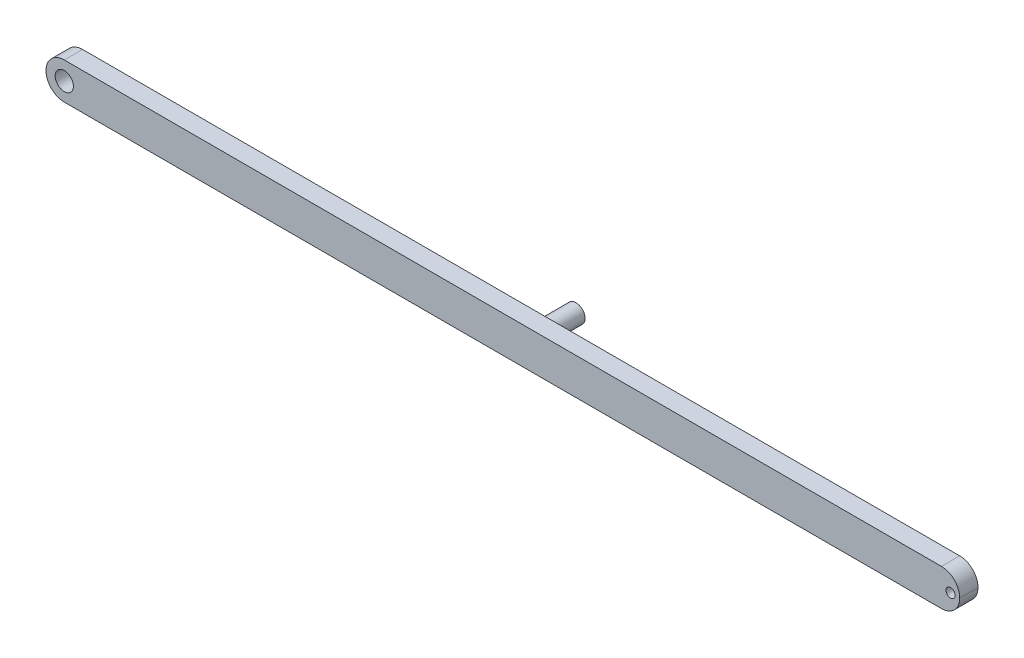
from build123d import *

# Parameters (mm, degrees)
SKETCH1_W           = 500
SKETCH1_H           = 20
SKETCH1_R           = 5
SKETCH1_R_2         = 2.5
BOSS_EXTRUDE1_DEPTH = 10
FILLET1_R           = 10
SKETCH2_R           = 5
BOSS_EXTRUDE2_DEPTH = 20
FILLET2_R           = 5


with BuildPart() as part:
    # Sketch1 → Boss-Extrude1 (new body)
    with BuildSketch(Plane.XY):
        Rectangle(SKETCH1_W, SKETCH1_H)
        with Locations((-240, 0)):
            Circle(SKETCH1_R, mode=Mode.SUBTRACT)
        with Locations((245, 0)):
            Circle(SKETCH1_R_2, mode=Mode.SUBTRACT)
    extrude(amount=BOSS_EXTRUDE1_DEPTH)

    # Fillet1
    fillet1_edges = [part.edges().sort_by_distance(p)[0] for p in [
        (250, -10, 5),
        (250, 10, 5),
        (-250, -10, 5),
        (-250, 10, 5),
    ]]
    fillet(fillet1_edges, radius=FILLET1_R - 0.0001)  # a hair under: the kernel refuses the full size

    # Sketch2 → Boss-Extrude2 (add)
    with BuildSketch(Plane(origin=(0, 0, 0), x_dir=(-1, 0, 0), z_dir=(0, 0, -1))):
        with Locations(Location((-10, 0, 0), (0, 0, 180))):
            Circle(SKETCH2_R)
    extrude(amount=BOSS_EXTRUDE2_DEPTH)

    # Fillet2
    fillet2_edges = [part.edges().sort_by_distance(p)[0] for p in [
        (5, 0, 0),
    ]]
    fillet(fillet2_edges, radius=FILLET2_R - 0.0001)  # a hair under: the kernel refuses the full size


solid = part.part
